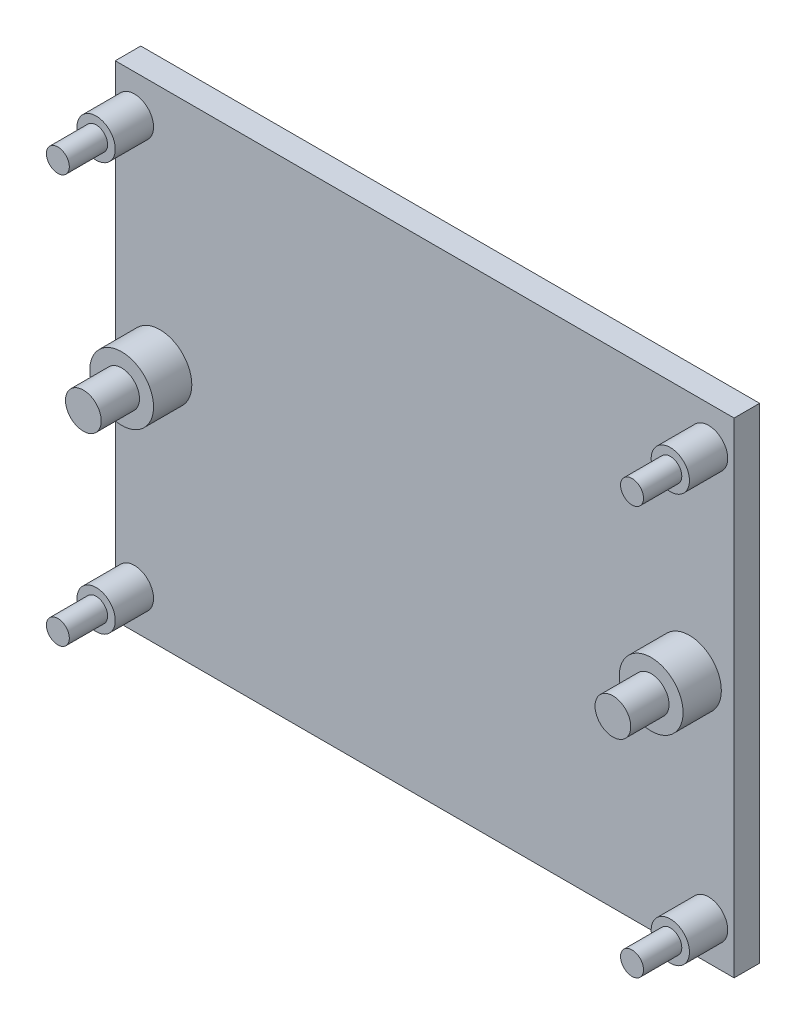
from build123d import *

# Parameters (mm, degrees)
SKIZZE2_2_W                     = 38
SKIZZE2_2_H                     = 48.5
AUFSATZ_LINEAR_AUSTRAGEN1_DEPTH = 2
SKIZZE4_R                       = 2.5
SKIZZE4_R_2                     = 1.5
AUFSATZ_LINEAR_AUSTRAGEN2_DEPTH = 3
SKIZZE5_R                       = 0.9
SKIZZE5_R_2                     = 1.4
AUFSATZ_LINEAR_AUSTRAGEN3_DEPTH = 3


with BuildPart() as part:
    # Skizze1 → Ausformung3 section 0
    with BuildSketch(Plane(origin=(0, 0, 0), x_dir=(0, 1, 0), z_dir=(0, 0, 1))):
        with BuildLine():
            Line((-4.85, 8.400446417), (-9.7, 0))
            Line((-9.7, 0), (-4.85, -8.400446417))
            Line((-4.85, -8.400446417), (4.85, -8.400446417))
            Line((4.85, -8.400446417), (9.7, 0))
            Line((9.7, 0), (4.85, 8.400446417))
            Line((4.85, 8.400446417), (-4.85, 8.400446417))
        make_face()
    # Skizze3 → Ausformung3 section 1
    with BuildSketch(Plane(origin=(0, 0, 2.5), x_dir=(0, 1, 0), z_dir=(0, 0, 1))):
        with BuildLine():
            Line((4.85, 8.400446417), (-4.85, 8.400446417))
            Line((-4.85, 8.400446417), (-9.7, 0))
            Line((-9.7, 0), (-4.85, -8.400446417))
            Line((-4.85, -8.400446417), (4.85, -8.400446417))
            Line((4.85, -8.400446417), (9.7, 0))
            Line((9.7, 0), (4.85, 8.400446417))
        make_face()
    loft()

    # Ausformung4: read off the stored shape, not the designer's step
    # Ausformung4: loft between two sections, ruled curve by curve
    ausformung4_from = [
        Edge.make_bspline([(24.25, -19, 5), (20.208333333, -19, 5), (16.166666667, -19, 5), (8.083333333, -19, 5), (4.041666667, -19, 5), (0, -19, 5)], [0, 0, 0, 0, 0.5, 0.5, 1, 1, 1, 1], 3),
        Edge.make_bspline([(0, -19, 5), (-4.041666667, -19, 5), (-8.083333333, -19, 5), (-16.166666667, -19, 5), (-20.208333333, -19, 5), (-24.25, -19, 5)], [0, 0, 0, 0, 0.5, 0.5, 1, 1, 1, 1], 3),
        Edge.make_bspline([(-24.25, 19, 5), (-20.208333333, 19, 5), (-16.166666667, 19, 5), (-8.083333333, 19, 5), (-4.041666667, 19, 5), (0, 19, 5)], [0, 0, 0, 0, 0.5, 0.5, 1, 1, 1, 1], 3),
        Edge.make_bspline([(0, 19, 5), (4.041666667, 19, 5), (8.083333333, 19, 5), (16.166666667, 19, 5), (20.208333333, 19, 5), (24.25, 19, 5)], [0, 0, 0, 0, 0.5, 0.5, 1, 1, 1, 1], 3),
        Edge.make_line((24.25, -19, 5), (24.25, 19, 5)),
        Edge.make_line((-24.25, 19, 5), (-24.25, -19, 5)),
    ]
    ausformung4_to = [
        Edge.make_bspline([(8.400446417, -4.85, 2.5), (7.000372014, -5.658333333, 2.5), (5.600297611, -6.466666667, 2.5), (2.800148806, -8.083333333, 2.5), (1.400074403, -8.891666667, 2.5), (0, -9.7, 2.5)], [0, 0, 0, 0, 0.5, 0.5, 1, 1, 1, 1], 3),
        Edge.make_bspline([(0, -9.7, 2.5), (-1.400074403, -8.891666667, 2.5), (-2.800148806, -8.083333333, 2.5), (-5.600297611, -6.466666667, 2.5), (-7.000372014, -5.658333333, 2.5), (-8.400446417, -4.85, 2.5)], [0, 0, 0, 0, 0.5, 0.5, 1, 1, 1, 1], 3),
        Edge.make_bspline([(-8.400446417, 4.85, 2.5), (-7.000372014, 5.658333333, 2.5), (-5.600297611, 6.466666667, 2.5), (-2.800148806, 8.083333333, 2.5), (-1.400074403, 8.891666667, 2.5), (0, 9.7, 2.5)], [0, 0, 0, 0, 0.5, 0.5, 1, 1, 1, 1], 3),
        Edge.make_bspline([(0, 9.7, 2.5), (1.400074403, 8.891666667, 2.5), (2.800148806, 8.083333333, 2.5), (5.600297611, 6.466666667, 2.5), (7.000372014, 5.658333333, 2.5), (8.400446417, 4.85, 2.5)], [0, 0, 0, 0, 0.5, 0.5, 1, 1, 1, 1], 3),
        Edge.make_line((8.400446417, -4.85, 2.5), (8.400446417, 4.85, 2.5)),
        Edge.make_line((-8.400446417, 4.85, 2.5), (-8.400446417, -4.85, 2.5)),
    ]
    ausformung4 = Solid(Shell([*[Face.make_surface_from_curves(ausformung4_from[k], ausformung4_to[k]) for k in range(6)], Face(Wire(ausformung4_from)), Face(Wire(ausformung4_to))]))
    add(ausformung4)

    # Skizze2<2> → Aufsatz-Linear austragen1 (add)
    with BuildSketch(Plane(origin=(0, 0, 5), x_dir=(0, 1, 0), z_dir=(0, 0, 1))):
        Rectangle(SKIZZE2_2_W, SKIZZE2_2_H)
    extrude(amount=AUFSATZ_LINEAR_AUSTRAGEN1_DEPTH)

    # Skizze4 → Aufsatz-Linear austragen2 (add)
    with BuildSketch(Plane.XY.offset(7)):
        with Locations((-20.75, 0)):
            Circle(SKIZZE4_R)
        with Locations((20.75, 0)):
            Circle(SKIZZE4_R)
        with Locations(Location((-22.75, 16, 0), (0, 0, 180))):
            Circle(SKIZZE4_R_2)
        with Locations(Location((-22.75, -16, 0), (0, 0, 180))):
            Circle(SKIZZE4_R_2)
        with Locations((22.25, 16)):
            Circle(SKIZZE4_R_2)
        with Locations((22.25, -16)):
            Circle(SKIZZE4_R_2)
    extrude(amount=AUFSATZ_LINEAR_AUSTRAGEN2_DEPTH)

    # Skizze5 → Aufsatz-Linear austragen3 (add)
    with BuildSketch(Plane.XY.offset(10)):
        with Locations((-22.75, 16)):
            Circle(SKIZZE5_R)
        with Locations((-22.75, -16)):
            Circle(SKIZZE5_R)
        with Locations((-20.75, 0)):
            Circle(SKIZZE5_R_2)
        with Locations((20.75, 0)):
            Circle(SKIZZE5_R_2)
        with Locations((22.25, 16)):
            Circle(SKIZZE5_R)
        with Locations((22.25, -16)):
            Circle(SKIZZE5_R)
    extrude(amount=AUFSATZ_LINEAR_AUSTRAGEN3_DEPTH)


solid = part.part
